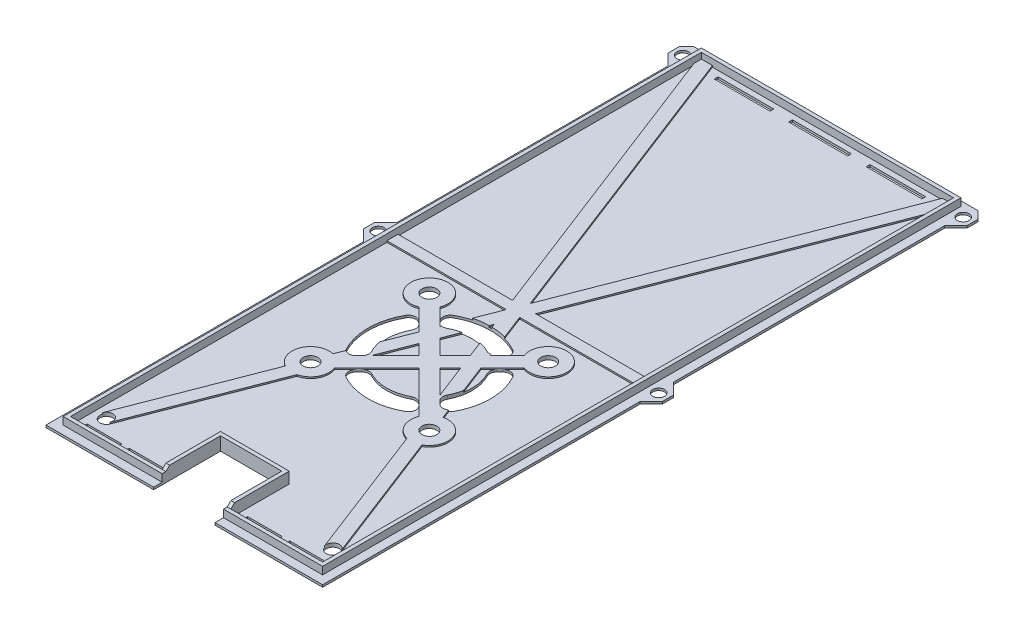
from build123d import *

# Parameters (mm, degrees)
SKETCH1_W               = 74.5
SKETCH1_H               = 176.5
BOSS_EXTRUDE1_DEPTH     = 0.6
SKETCH2_W               = 69.9
SKETCH2_H               = 171.9
SKETCH2_W_2             = 67.9
SKETCH2_H_2             = 169.9
BOSS_EXTRUDE2_DEPTH     = 2
CUT_EXTRUDE1_DEPTH      = 12
CUT_EXTRUDE1_DEPTH_BACK = 12
SKETCH3_W               = 16.5
SKETCH3_H               = 18
BOSS_EXTRUDE3_DEPTH     = 3
CHAMFER1_SIZE           = 1
SKETCH5_R               = 1.75
CUT_EXTRUDE2_DEPTH      = 3
SKETCH6_W               = 3
SKETCH6_H               = 3
BOSS_EXTRUDE4_DEPTH     = 0.6
CHAMFER2_SIZE           = 3
SKETCH7_R               = 1.6
CUT_EXTRUDE3_DEPTH      = 0.6
BOSS_EXTRUDE5_DEPTH     = 0.6
SKETCH9_R               = 1.6
CUT_EXTRUDE4_DEPTH      = 0.6
BOSS_EXTRUDE6_DEPTH     = 0.4
SKETCH11_W              = 82.910510583
SKETCH11_H              = 4.380950436
CUT_EXTRUDE5_DEPTH      = 10
SKETCH12_R              = 2
CUT_EXTRUDE6_DEPTH      = 10
SKETCH13_R              = 5
SKETCH13_R_2            = 2
BOSS_EXTRUDE7_DEPTH     = 0.4
CUT_EXTRUDE7_DEPTH      = 1
BOSS_EXTRUDE8_DEPTH     = 0.4
SKETCH16_W              = 9.35
SKETCH16_H              = 1
SKETCH16_W_2            = 15
SKETCH16_W_3            = 15.9
CUT_EXTRUDE8_DEPTH      = 10


# Read off the part's stored shape, not the designer's step: Boss-Extrude6
with BuildPart() as part:
    # Sketch1 → Boss-Extrude1 (new body)
    with BuildSketch(Plane(origin=(0, 0, 0), x_dir=(1, 0, 0), z_dir=(0, 1, 0))):
        Rectangle(SKETCH1_W, SKETCH1_H)
    extrude(amount=BOSS_EXTRUDE1_DEPTH)

    # Sketch2 → Boss-Extrude2 (add)
    with BuildSketch(Plane(origin=(0, 0.6, 0), x_dir=(1, 0, 0), z_dir=(0, 1, 0))):
        Rectangle(SKETCH2_W, SKETCH2_H)
        Rectangle(SKETCH2_W_2, SKETCH2_H_2, mode=Mode.SUBTRACT)
    extrude(amount=BOSS_EXTRUDE2_DEPTH)

    # Sketch3 → Cut-Extrude1 (cut, two sides: drawn at the far end of the back side and taken through both)
    with BuildSketch(Plane(origin=(0, 0.6, 0), x_dir=(1, 0, 0), z_dir=(0, 1, 0)).offset(-CUT_EXTRUDE1_DEPTH_BACK)):
        with Locations((0, -79.25)):
            Rectangle(SKETCH3_W, SKETCH3_H)
    extrude(amount=CUT_EXTRUDE1_DEPTH + CUT_EXTRUDE1_DEPTH_BACK, mode=Mode.SUBTRACT)

    # Sketch4 → Boss-Extrude3 (add)
    with BuildSketch(Plane(origin=(0, 0.6, 0), x_dir=(1, 0, 0), z_dir=(0, 1, 0))):
        Polygon((-8.25, -84.95), (-9.25, -84.95), (-9.25, -69.25), (-7.551934527, -69.25), (8.948065473, -69.25), (9.25, -69.25), (9.25, -84.95), (8.25, -84.95), (8.25, -70.25), (-8.25, -70.25), align=None)
    extrude(amount=BOSS_EXTRUDE3_DEPTH)

    # Chamfer1
    chamfer1_edges = [part.edges().sort_by_distance(p)[0] for p in [
        (-8.75, 3.6, 84.95),
        (8.75, 3.6, 84.95),
    ]]
    chamfer(chamfer1_edges, length=CHAMFER1_SIZE - 0.0001)  # a hair under: the kernel refuses the full size

    # Sketch5 → Cut-Extrude2 (cut)
    with BuildSketch(Plane(origin=(0, 0.6, 0), x_dir=(1, 0, 0), z_dir=(0, 1, 0))):
        with Locations(Location((-30.5, -78.75, 0), (0, 0, 270))):
            Circle(SKETCH5_R)
        with Locations(Location((30.5, -78.75, 0), (0, 0, 270))):
            Circle(SKETCH5_R)
    extrude(amount=-CUT_EXTRUDE2_DEPTH, mode=Mode.SUBTRACT)

    # Sketch6 → Boss-Extrude4 (add)
    with BuildSketch(Plane(origin=(0, 0.6, 0), x_dir=(1, 0, 0), z_dir=(0, 1, 0))):
        with Locations((-38.75, 1.75)):
            Rectangle(SKETCH6_W, SKETCH6_H)
        with Locations((38.75, 1.75)):
            Rectangle(SKETCH6_W, SKETCH6_H)
    extrude(amount=-BOSS_EXTRUDE4_DEPTH)

    # Chamfer2
    chamfer2_edges = [part.edges().sort_by_distance(p)[0] for p in [
        (37.25, 0.3, -3.25),
        (37.25, 0.3, -0.25),
        (-37.25, 0.3, -0.25),
        (-37.25, 0.3, -3.25),
    ]]
    chamfer(chamfer2_edges, length=CHAMFER2_SIZE - 0.0001)  # a hair under: the kernel refuses the full size

    # Sketch7 → Cut-Extrude3 (cut)
    with BuildSketch(Plane(origin=(0, 0.6, 0), x_dir=(1, 0, 0), z_dir=(0, 1, 0))):
        with Locations(Location((-37.75, 1.75, 0), (0, 0, 270))):
            Circle(SKETCH7_R)
        with Locations(Location((37.75, 1.75, 0), (0, 0, 270))):
            Circle(SKETCH7_R)
    extrude(amount=-CUT_EXTRUDE3_DEPTH, mode=Mode.SUBTRACT)

    # Sketch8 → Boss-Extrude5 (add)
    with BuildSketch(Plane(origin=(0, 0.6, 0), x_dir=(1, 0, 0), z_dir=(0, 1, 0))):
        Polygon((-37.25, 88.25), (-40.25, 85.25), (-40.25, 82.25), (-37.25, 79.25), align=None)
        Polygon((37.25, 88.25), (40.25, 85.25), (40.25, 82.25), (37.25, 79.25), align=None)
    extrude(amount=-BOSS_EXTRUDE5_DEPTH)

    # Sketch9 → Cut-Extrude4 (cut)
    with BuildSketch(Plane(origin=(0, 0.6, 0), x_dir=(1, 0, 0), z_dir=(0, 1, 0))):
        with Locations(Location((-37.75, 83.75, 0), (0, 0, 270))):
            Circle(SKETCH9_R)
        with Locations(Location((37.75, 83.75, 0), (0, 0, 270))):
            Circle(SKETCH9_R)
    extrude(amount=-CUT_EXTRUDE4_DEPTH, mode=Mode.SUBTRACT)

    # Boss-Extrude6 outline → Boss-Extrude6 (add)
    with BuildSketch(Plane(origin=(0, 0.6, 0), x_dir=(1, 0, 0), z_dir=(0, 1, 0))):
        with BuildLine():
            ThreePointArc((-32.125499404, -78.101731779), (-29.868435096, -77.117938184), (-28.861547407, -79.36479517))
            Line((-28.861547407, -79.36479517), (0.000140318, -4.781710933))
            Line((0.000140318, -4.781710933), (28.85227045, -79.33948056))
            ThreePointArc((28.85227045, -79.33948056), (29.868430555, -77.117939941), (32.115315669, -78.07675763))
            Line((32.115315669, -78.07675763), (1.875977439, 0.065743567))
            Line((1.875977439, 0.065743567), (1.947279822, 0.25))
            Line((1.947279822, 0.25), (33.95, 0.25))
            Line((33.95, 0.25), (33.95, 3.25))
            Line((33.95, 3.25), (3.108200747, 3.25))
            Line((3.108200747, 3.25), (33.95, 82.95))
            Line((33.95, 82.95), (33.95, 84.95))
            Line((33.95, 84.95), (30.971223046, 84.95))
            Line((30.971223046, 84.95), (-0.000392435, 4.914534701))
            Line((-0.000392435, 4.914534701), (-30.972263932, 84.95))
            Line((-30.972263932, 84.95), (-33.95, 84.95))
            Line((-33.95, 84.95), (-33.95, 82.95))
            Line((-33.95, 82.95), (-3.107945804, 3.25))
            Line((-3.107945804, 3.25), (-33.95, 3.25))
            Line((-33.95, 3.25), (-33.95, 0.25))
            Line((-33.95, 0.25), (-1.947015282, 0.25))
            Line((-1.947015282, 0.25), (-1.876229556, 0.067080201))
            Line((-1.876229556, 0.067080201), (-32.125499404, -78.101731779))
        make_face()
    extrude(amount=BOSS_EXTRUDE6_DEPTH)

    # Sketch11 → Cut-Extrude5 (cut)
    with BuildSketch(Plane(origin=(0, 0.6, 0), x_dir=(1, 0, 0), z_dir=(0, 1, 0))):
        with Locations((0.072715858, 89.440475218)):
            Rectangle(SKETCH11_W, SKETCH11_H)
    extrude(amount=-CUT_EXTRUDE5_DEPTH, mode=Mode.SUBTRACT)

    # Sketch12 → Cut-Extrude6 (cut)
    with BuildSketch(Plane.XZ):
        with Locations(Location((-16, 38.25, 0), (0, 0, 270))):
            Circle(SKETCH12_R)
        with Locations(Location((16, 38.25, 0), (0, 0, 270))):
            Circle(SKETCH12_R)
        with Locations(Location((16, 6.25, 0), (0, 0, 270))):
            Circle(SKETCH12_R)
        with Locations(Location((-16, 6.25, 0), (0, 0, 270))):
            Circle(SKETCH12_R)
    extrude(amount=-CUT_EXTRUDE6_DEPTH, mode=Mode.SUBTRACT)

    # Sketch13 → Boss-Extrude7 (add)
    # profile 1 of 4: a face of its own
    with BuildSketch(Plane(origin=(0, 0.6, 0), x_dir=(1, 0, 0), z_dir=(0, 1, 0))):
        with Locations(Location((-16, -6.25, 0), (0, 0, 270))):
            Circle(SKETCH13_R)
        with Locations(Location((-16, -6.25, 0), (0, 0, 90))):
            Circle(SKETCH13_R_2, mode=Mode.SUBTRACT)
    # profile 2 of 4: a face of its own
    with BuildSketch(Plane(origin=(0, 0.6, 0), x_dir=(1, 0, 0), z_dir=(0, 1, 0))):
        with Locations(Location((16, -6.25, 0), (0, 0, 270))):
            Circle(SKETCH13_R)
        with Locations(Location((16, -6.25, 0), (0, 0, 90))):
            Circle(SKETCH13_R_2, mode=Mode.SUBTRACT)
    # profile 3 of 4: a face of its own
    with BuildSketch(Plane(origin=(0, 0.6, 0), x_dir=(1, 0, 0), z_dir=(0, 1, 0))):
        with Locations((16, -38.25)):
            Circle(SKETCH13_R)
        with Locations(Location((16, -38.25, 0), (0, 0, 90))):
            Circle(SKETCH13_R_2, mode=Mode.SUBTRACT)
    # profile 4 of 4: a face of its own
    with BuildSketch(Plane(origin=(0, 0.6, 0), x_dir=(1, 0, 0), z_dir=(0, 1, 0))):
        with Locations((-16, -38.25)):
            Circle(SKETCH13_R)
        with Locations(Location((-16, -38.25, 0), (0, 0, 90))):
            Circle(SKETCH13_R_2, mode=Mode.SUBTRACT)
    extrude(amount=BOSS_EXTRUDE7_DEPTH)

    # Sketch14 → Cut-Extrude7 (cut)
    with BuildSketch(Plane.XZ):
        with BuildLine():
            Line((8.44098811, 10.980584765), (7.703077702, 11.718495173))
            ThreePointArc((7.703077702, 11.718495173), (6.588543732, 12.281702189), (5.357180563, 12.074017669))
            ThreePointArc((5.357180563, 12.074017669), (0, 10.75), (-5.357180563, 12.074017669))
            ThreePointArc((-5.357180563, 12.074017669), (-6.588543732, 12.281702189), (-7.703077702, 11.718495173))
            Line((-7.703077702, 11.718495173), (-8.44098811, 10.980584765))
            ThreePointArc((-8.44098811, 10.980584765), (-9.007278136, 9.287793501), (-7.99598483, 7.816905162))
            ThreePointArc((-7.99598483, 7.816905162), (0, 5.75), (7.99598483, 7.816905162))
            ThreePointArc((7.99598483, 7.816905162), (9.007278136, 9.287793501), (8.44098811, 10.980584765))
        make_face()
        with BuildLine():
            Line((11.269415235, 13.80901189), (10.531504827, 14.546922298))
            ThreePointArc((10.531504827, 14.546922298), (9.968297811, 15.661456268), (10.175982331, 16.892819437))
            ThreePointArc((10.175982331, 16.892819437), (11.5, 22.25), (10.175982331, 27.607180563))
            ThreePointArc((10.175982331, 27.607180563), (9.968297811, 28.838543732), (10.531504827, 29.953077702))
            Line((10.531504827, 29.953077702), (11.269415235, 30.69098811))
            ThreePointArc((11.269415235, 30.69098811), (12.962206499, 31.257278136), (14.433094838, 30.24598483))
            ThreePointArc((14.433094838, 30.24598483), (16.5, 22.25), (14.433094838, 14.25401517))
            ThreePointArc((14.433094838, 14.25401517), (12.962206499, 13.242721864), (11.269415235, 13.80901189))
        make_face()
        with BuildLine():
            Line((8.44098811, 33.519415235), (7.703077702, 32.781504827))
            ThreePointArc((7.703077702, 32.781504827), (6.588543732, 32.218297811), (5.357180563, 32.425982331))
            ThreePointArc((5.357180563, 32.425982331), (0, 33.75), (-5.357180563, 32.425982331))
            ThreePointArc((-5.357180563, 32.425982331), (-6.588543732, 32.218297811), (-7.703077702, 32.781504827))
            Line((-7.703077702, 32.781504827), (-8.44098811, 33.519415235))
            ThreePointArc((-8.44098811, 33.519415235), (-9.007278136, 35.212206499), (-7.99598483, 36.683094838))
            ThreePointArc((-7.99598483, 36.683094838), (0, 38.75), (7.99598483, 36.683094838))
            ThreePointArc((7.99598483, 36.683094838), (9.007278136, 35.212206499), (8.44098811, 33.519415235))
        make_face()
        with BuildLine():
            Line((-10.531504827, 14.546922298), (-11.269415235, 13.80901189))
            ThreePointArc((-11.269415235, 13.80901189), (-12.962206499, 13.242721864), (-14.433094838, 14.25401517))
            ThreePointArc((-14.433094838, 14.25401517), (-16.5, 22.25), (-14.433094838, 30.24598483))
            ThreePointArc((-14.433094838, 30.24598483), (-12.962206499, 31.257278136), (-11.269415235, 30.69098811))
            Line((-11.269415235, 30.69098811), (-10.531504827, 29.953077702))
            ThreePointArc((-10.531504827, 29.953077702), (-9.968297811, 28.838543732), (-10.175982331, 27.607180563))
            ThreePointArc((-10.175982331, 27.607180563), (-11.5, 22.25), (-10.175982331, 16.892819437))
            ThreePointArc((-10.175982331, 16.892819437), (-9.968297811, 15.661456268), (-10.531504827, 14.546922298))
        make_face()
    extrude(amount=-CUT_EXTRUDE7_DEPTH, mode=Mode.SUBTRACT)

    # Sketch15 → Boss-Extrude8 (add)
    with BuildSketch(Plane(origin=(0, 0.6, 0), x_dir=(1, 0, 0), z_dir=(0, 1, 0))):
        Polygon((-14.173843213, -10.904583912), (-2.828427125, -22.25), (-14.173843213, -33.595416088), (-11.345416088, -36.423843213), (0, -25.078427125), (11.345416088, -36.423843213), (14.173843213, -33.595416088), (2.828427125, -22.25), (14.173843213, -10.904583912), (11.345416088, -8.076156787), (0, -19.421572875), (-11.345416088, -8.076156787), align=None)
    extrude(amount=BOSS_EXTRUDE8_DEPTH)

    # Sketch16 → Cut-Extrude8 (cut)
    with BuildSketch(Plane(origin=(0, 0.6, 0), x_dir=(1, 0, 0), z_dir=(0, 1, 0))):
        with Locations((-27.275, -82.95)):
            Rectangle(SKETCH16_W, SKETCH16_H)
        with Locations((-15.925, -82.95)):
            Rectangle(SKETCH16_W, SKETCH16_H)
        with Locations((15.925, -82.95)):
            Rectangle(SKETCH16_W, SKETCH16_H)
        with Locations((27.275, -82.95)):
            Rectangle(SKETCH16_W, SKETCH16_H)
        with Locations((-20.45, 82.95)):
            Rectangle(SKETCH16_W_2, SKETCH16_H)
        with Locations((0, 82.95)):
            Rectangle(SKETCH16_W_3, SKETCH16_H)
        with Locations((20.45, 82.95)):
            Rectangle(SKETCH16_W_2, SKETCH16_H)
    extrude(amount=-CUT_EXTRUDE8_DEPTH, mode=Mode.SUBTRACT)


solid = part.part
